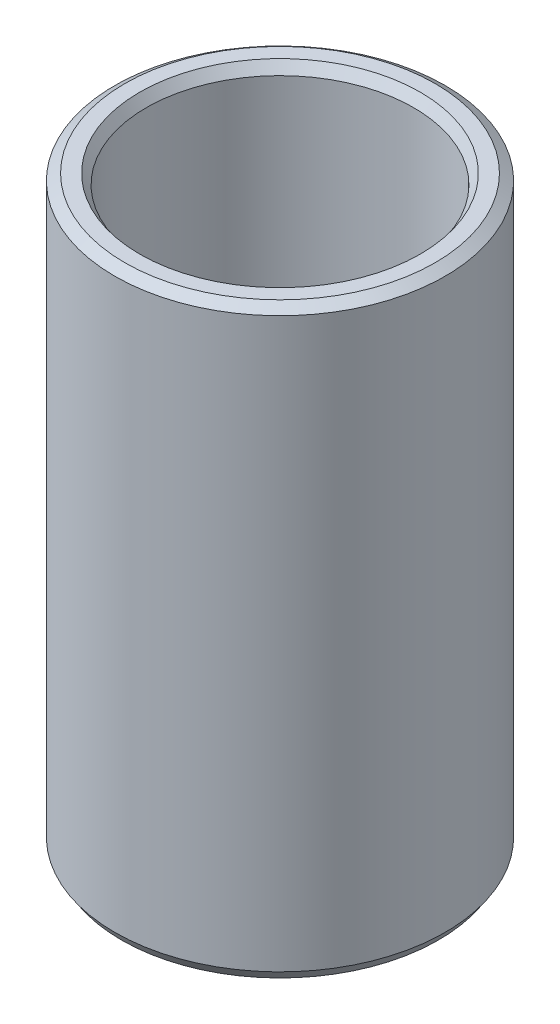
from build123d import *
from OCP.BRepFilletAPI import BRepFilletAPI_MakeChamfer

# Parameters (mm, degrees)
SKETCH1_R           = 40
BOSS_EXTRUDE1_DEPTH = 141.631600405
SKETCH2_R           = 32.352926813
CUT_EXTRUDE1_DEPTH  = 153.510688915
CHAMFER1_SIZE       = 1.618416355
CHAMFER1_SIZE2      = 2.427624318


with BuildPart() as part:
    # Sketch1 → Boss-Extrude1 (new body)
    with BuildSketch(Plane(origin=(0, 0, 0), x_dir=(1, 0, 0), z_dir=(0, 1, 0))):
        Circle(SKETCH1_R)
    extrude(amount=BOSS_EXTRUDE1_DEPTH)

    # Sketch2 → Cut-Extrude1 (cut, through all)
    with BuildSketch(Plane(origin=(0, 0, 0), x_dir=(1, 0, 0), z_dir=(0, 1, 0))):
        Circle(SKETCH2_R)
    extrude(amount=CUT_EXTRUDE1_DEPTH, mode=Mode.SUBTRACT)

    # Chamfer1: one chamfer whose edges measure the first distance from different faces: ONE call of the kernel's chamfer builder (chamfer() names one face for all edges)
    chamfer1_edges_1 = [part.edges().sort_by_distance(p)[0] for p in [
        (-32.352926813, 141.631600405, 0),
    ]]
    chamfer1_side_1 = [part.faces().sort_by_distance(p)[0] for p in [
        (-38.86862915, 141.631600405, 0),
    ]]
    chamfer1_edges_2 = [part.edges().sort_by_distance(p)[0] for p in [
        (-32.352926813, 0, 0),
    ]]
    chamfer1_side_2 = [part.faces().sort_by_distance(p)[0] for p in [
        (-32.352926813, 70.815800203, 0),
    ]]
    chamfer1_edges_3 = [part.edges().sort_by_distance(p)[0] for p in [
        (-40, 0, 0),
    ]]
    chamfer1_side_3 = [part.faces().sort_by_distance(p)[0] for p in [
        (-38.86862915, 0, 0),
    ]]
    chamfer1_edges_4 = [part.edges().sort_by_distance(p)[0] for p in [
        (-40, 141.631600405, 0),
    ]]
    chamfer1_side_4 = [part.faces().sort_by_distance(p)[0] for p in [
        (-40, 70.815800203, 0),
    ]]
    chamfer1 = BRepFilletAPI_MakeChamfer(part.part.solid().wrapped)
    for e in chamfer1_edges_1:
        chamfer1.Add(CHAMFER1_SIZE, CHAMFER1_SIZE2, e.wrapped, chamfer1_side_1[0].wrapped)  # the first distance lies on this face
    for e in chamfer1_edges_2:
        chamfer1.Add(CHAMFER1_SIZE, CHAMFER1_SIZE2, e.wrapped, chamfer1_side_2[0].wrapped)  # the first distance lies on this face
    for e in chamfer1_edges_3:
        chamfer1.Add(CHAMFER1_SIZE, CHAMFER1_SIZE2, e.wrapped, chamfer1_side_3[0].wrapped)  # the first distance lies on this face
    for e in chamfer1_edges_4:
        chamfer1.Add(CHAMFER1_SIZE, CHAMFER1_SIZE2, e.wrapped, chamfer1_side_4[0].wrapped)  # the first distance lies on this face
    add(Compound.cast(chamfer1.Shape()), mode=Mode.REPLACE)


solid = part.part
